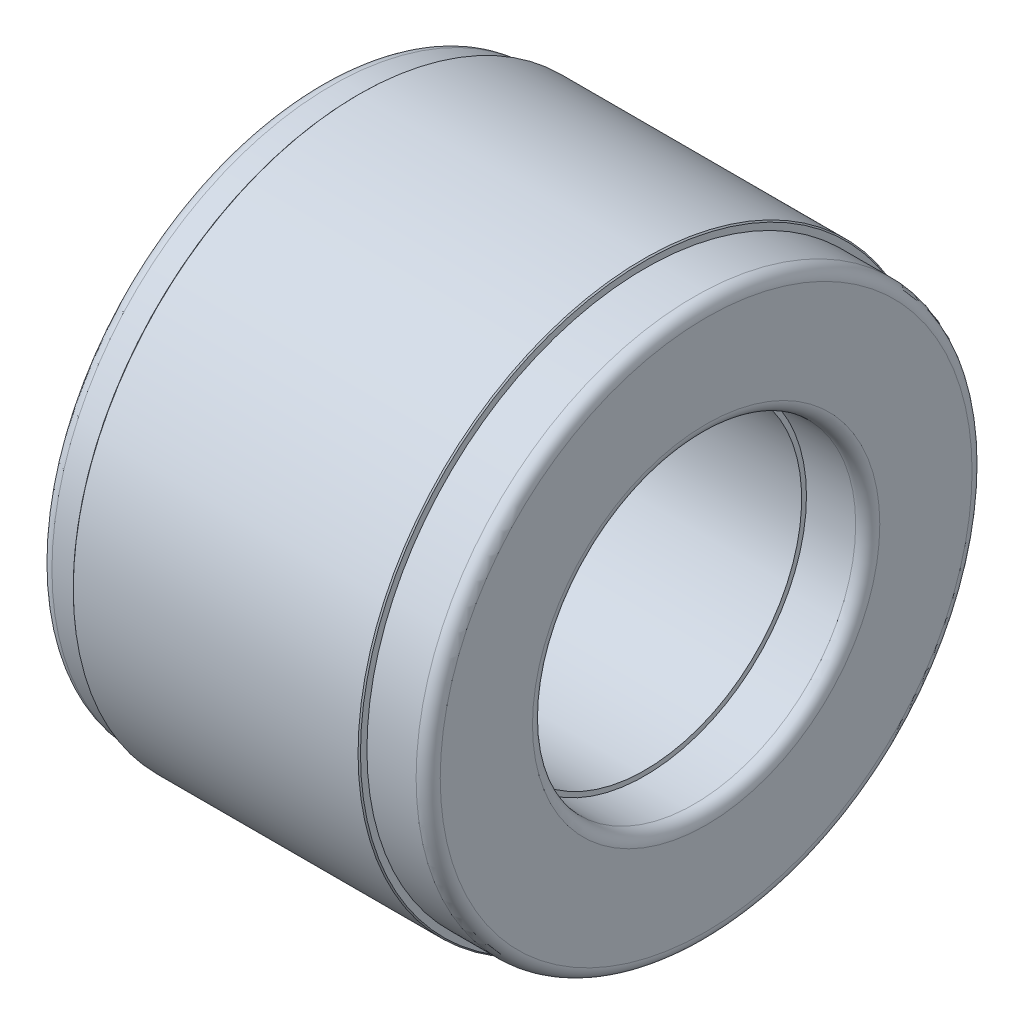
from build123d import *

# Parameters (mm, degrees)
FILLET1_R     = 2
CHAMFER1_SIZE = 0.2


with BuildPart() as part:
    # Sketch1 → Revolve1 (revolve)
    with BuildSketch(Plane.XY):
        Polygon((0, 46.355), (0, 27.305), (6.35, 27.305), (6.35, 26), (53.98, 26), (53.98, 26.8), (64.14, 26.8), (64.14, 46.1), (53.98, 46.1), (53.98, 47.37), (6.35, 47.37), (6.35, 46.355), align=None)
    revolve(axis=Axis((0, 0, 0), (1, 0, 0)))

    # Fillet1
    fillet1_edges = [part.edges().sort_by_distance(p)[0] for p in [
        (0, -27.305, 0),
        (0, -46.355, 0),
        (64.14, -26.8, 0),
        (64.14, -46.1, 0),
    ]]
    fillet(fillet1_edges, radius=FILLET1_R)

    # Chamfer1
    chamfer1_edges = [part.edges().sort_by_distance(p)[0] for p in [
        (53.98, -47.37, 0),
        (6.35, -47.37, 0),
    ]]
    chamfer(chamfer1_edges, length=CHAMFER1_SIZE)


solid = part.part
